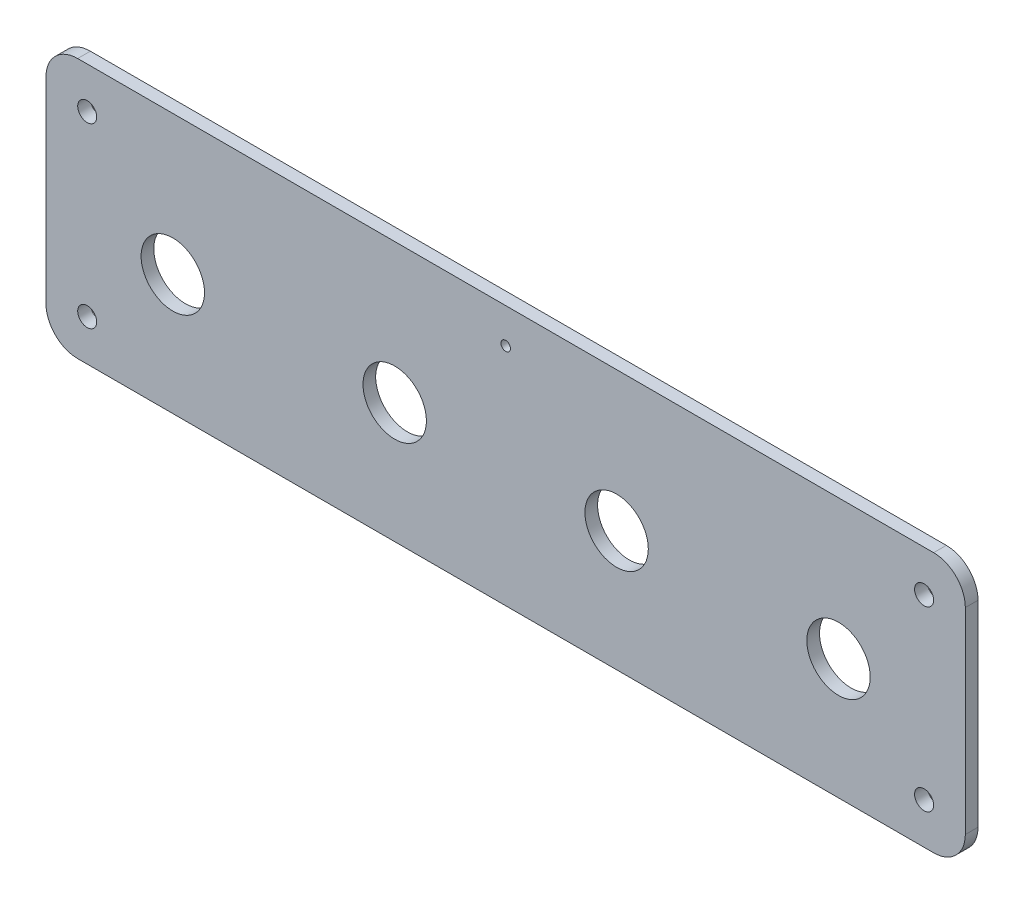
from build123d import *

# Parameters (mm, degrees)
CROQUIS1_R              = 5
CROQUIS1_R_2            = 0.75
CROQUIS1_R_3            = 1.5
SALIENTE_EXTRUIR1_DEPTH = 2


with BuildPart() as part:
    # Croquis1 → Saliente-Extruir1 (new body)
    with BuildSketch(Plane.XY):
        with BuildLine():
            Line((-67.5, -20.5), (67.5, -20.5))
            ThreePointArc((67.5, -20.5), (71.035533906, -19.035533906), (72.5, -15.5))
            Line((72.5, -15.5), (72.5, 15.5))
            ThreePointArc((72.5, 15.5), (71.035533906, 19.035533906), (67.5, 20.5))
            Line((67.5, 20.5), (-67.5, 20.5))
            ThreePointArc((-67.5, 20.5), (-71.035533906, 19.035533906), (-72.5, 15.5))
            Line((-72.5, 15.5), (-72.5, -15.5))
            ThreePointArc((-72.5, -15.5), (-71.035533906, -19.035533906), (-67.5, -20.5))
        make_face()
        with Locations((-52.5, -1.5)):
            Circle(CROQUIS1_R, mode=Mode.SUBTRACT)
        with Locations((-17.5, -1.5)):
            Circle(CROQUIS1_R, mode=Mode.SUBTRACT)
        with Locations((17.5, -1.5)):
            Circle(CROQUIS1_R, mode=Mode.SUBTRACT)
        with Locations((52.5, -1.5)):
            Circle(CROQUIS1_R, mode=Mode.SUBTRACT)
        with Locations((0, 15)):
            Circle(CROQUIS1_R_2, mode=Mode.SUBTRACT)
        with Locations((-66, 14)):
            Circle(CROQUIS1_R_3, mode=Mode.SUBTRACT)
        with Locations((-66, -14)):
            Circle(CROQUIS1_R_3, mode=Mode.SUBTRACT)
        with Locations((66, -14)):
            Circle(CROQUIS1_R_3, mode=Mode.SUBTRACT)
        with Locations((66, 14)):
            Circle(CROQUIS1_R_3, mode=Mode.SUBTRACT)
    extrude(amount=-SALIENTE_EXTRUIR1_DEPTH)


solid = part.part
